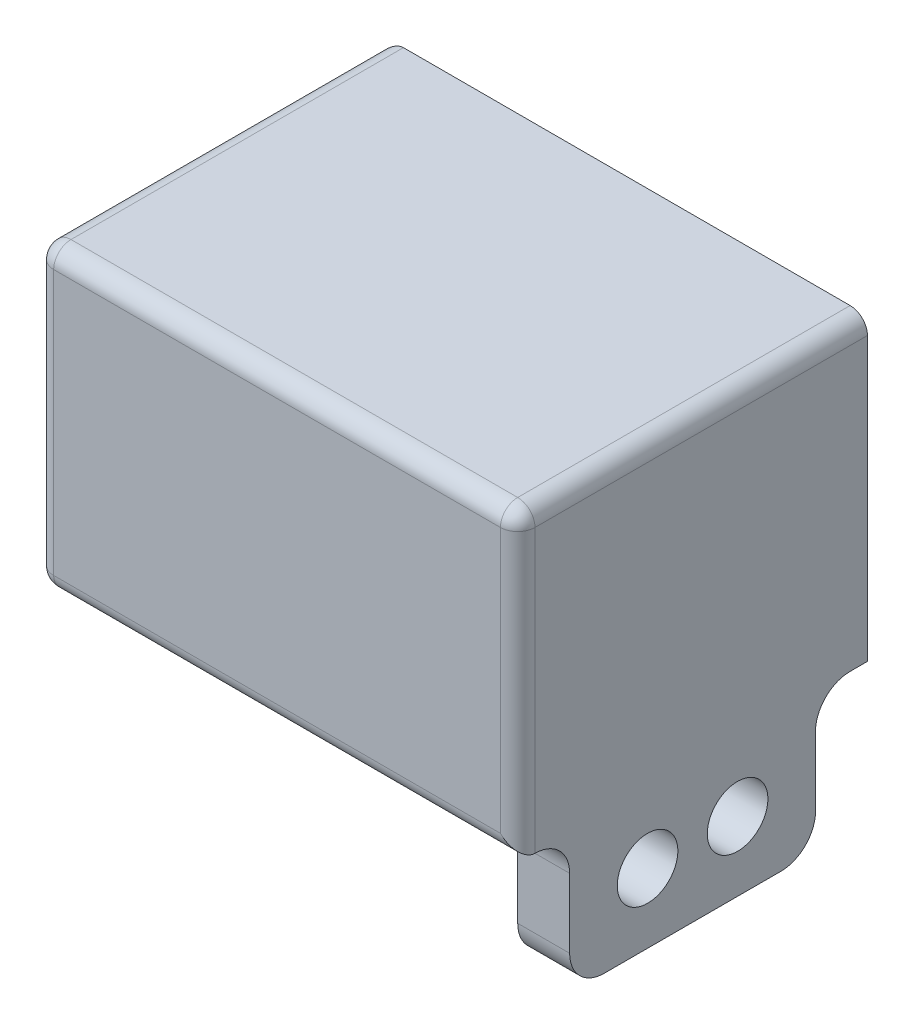
from build123d import *

# Parameters (mm, degrees)
SKETCH1_W           = 22.8
SKETCH1_H           = 12.3
BOSS_EXTRUDE1_DEPTH = 2
SKETCH2_W           = 32.8
SKETCH2_H           = 17.3
SKETCH2_W_2         = 22.8
SKETCH2_H_2         = 12.3
BOSS_EXTRUDE2_DEPTH = 20.2
SKETCH3_W           = 15.2
SKETCH3_H           = 11.3
CUT_EXTRUDE1_DEPTH  = 5
FILLET1_R           = 1
SKETCH4_R           = 0.75
CUT_EXTRUDE2_DEPTH  = 5
SKETCH5_W           = 3.5
SKETCH5_H           = 17.3
CUT_EXTRUDE3_DEPTH  = 28.419381831
FILLET2_R           = 1
SKETCH8_W           = 14.2
SKETCH8_H           = 8
BOSS_EXTRUDE4_DEPTH = 3
SKETCH9_R           = 1.75
CUT_EXTRUDE5_DEPTH  = 37.057627487
FILLET4_R           = 2
SKETCH10_W          = 2.29579642
SKETCH10_H          = 17.3
CUT_EXTRUDE6_DEPTH  = 31.890492065
FILLET5_R           = 1
FILLET6_R           = 1


with BuildPart() as part:
    # Sketch1 → Boss-Extrude1 (new body)
    with BuildSketch(Plane.XY):
        Rectangle(SKETCH1_W, SKETCH1_H)
    extrude(amount=BOSS_EXTRUDE1_DEPTH)

    # Sketch2 → Boss-Extrude2 (add)
    with BuildSketch(Plane.XY.offset(2)):
        Rectangle(SKETCH2_W, SKETCH2_H)
        Rectangle(SKETCH2_W_2, SKETCH2_H_2, mode=Mode.SUBTRACT)
    extrude(amount=-BOSS_EXTRUDE2_DEPTH)

    # Sketch3 → Cut-Extrude1 (cut)
    with BuildSketch(Plane.ZY.offset(16.4)):
        with Locations((-10.6, 0)):
            Rectangle(SKETCH3_W, SKETCH3_H)
    extrude(amount=-CUT_EXTRUDE1_DEPTH, mode=Mode.SUBTRACT)

    # Fillet1
    fillet1_edges = [part.edges().sort_by_distance(p)[0] for p in [
        (-13.9, 5.65, -3),
        (-13.9, -5.65, -3),
    ]]
    fillet(fillet1_edges, radius=FILLET1_R)

    # Sketch4 → Cut-Extrude2 (cut)
    with BuildSketch(Plane(origin=(0, 0, -18.2), x_dir=(-1, 0, 0), z_dir=(0, 0, -1))):
        with Locations((-13.75, 0)):
            Circle(SKETCH4_R)
    extrude(amount=-CUT_EXTRUDE2_DEPTH, mode=Mode.SUBTRACT)

    # Sketch5 → Cut-Extrude3 (cut, through all)
    with BuildSketch(Plane(origin=(0, 0, -18.2), x_dir=(-1, 0, 0), z_dir=(0, 0, -1))):
        with Locations((14.65, 0)):
            Rectangle(SKETCH5_W, SKETCH5_H)
    extrude(amount=-CUT_EXTRUDE3_DEPTH, mode=Mode.SUBTRACT)

    # Fillet2
    fillet2_edges = [part.edges().sort_by_distance(p)[0] for p in [
        (16.4, 8.65, -8.1),
        (-12.9, 5.357106781, -3.292893219),
        (-12.9, -7.15, -18.2),
        (-12.9, 7.15, -18.2),
        (-12.9, -5.65, -11.1),
        (-12.9, -5.357106781, -3.292893219),
        (-12.9, 0, -3),
        (-12.9, 5.65, -11.1),
        (-12.9, 0, 2),
        (-12.9, -8.65, -8.1),
        (-12.9, 8.65, -8.1),
    ]]
    fillet(fillet2_edges, radius=FILLET2_R)

    # Sketch8 → Boss-Extrude4 (add)
    with BuildSketch(Plane(origin=(16.4, 0, 0), x_dir=(0, 0, -1), z_dir=(1, 0, 0))):
        with Locations((8.1, -12.65)):
            Rectangle(SKETCH8_W, SKETCH8_H)
    extrude(amount=-BOSS_EXTRUDE4_DEPTH)

    # Sketch9 → Cut-Extrude5 (cut, through all)
    with BuildSketch(Plane.ZY.offset(-13.4)):
        with Locations((-10.7, -12.65)):
            Circle(SKETCH9_R)
        with Locations((-5.5, -12.65)):
            Circle(SKETCH9_R)
    extrude(amount=-CUT_EXTRUDE5_DEPTH, mode=Mode.SUBTRACT)

    # Fillet4
    fillet4_edges = [part.edges().sort_by_distance(p)[0] for p in [
        (14.9, -16.65, -1),
        (14.9, -8.65, -1),
        (14.9, -8.65, -15.2),
        (14.9, -16.65, -15.2),
    ]]
    fillet(fillet4_edges, radius=FILLET4_R)

    # Sketch10 → Cut-Extrude6 (cut, through all)
    with BuildSketch(Plane(origin=(0, 0, -18.2), x_dir=(-1, 0, 0), z_dir=(0, 0, -1))):
        with Locations((12.54789821, 0)):
            Rectangle(SKETCH10_W, SKETCH10_H)
    extrude(amount=-CUT_EXTRUDE6_DEPTH, mode=Mode.SUBTRACT)

    # Fillet5
    fillet5_edges = [part.edges().sort_by_distance(p)[0] for p in [
        (16.4, -0.5, 2),
        (16.107106781, 8.357106781, 2),
        (-11.4, 6.15, -9.1),
        (-11.4, 7.4, -18.2),
        (-11.4, 8.65, -8.1),
        (-11.4, 0, 2),
        (-11.4, -8.65, -8.1),
        (-11.4, -7.4, -18.2),
        (-11.4, -6.15, -9.1),
        (-11.4, 0, 0),
        (2.5, -8.65, 2),
        (2, 8.65, 2),
    ]]
    fillet(fillet5_edges, radius=FILLET5_R - 0.0001)  # a hair under: the kernel refuses the full size

    # Fillet6
    fillet6_edges = [part.edges().sort_by_distance(p)[0] for p in [
        (13.4, -8.65, -8.1),
    ]]
    fillet(fillet6_edges, radius=FILLET6_R)


solid = part.part
